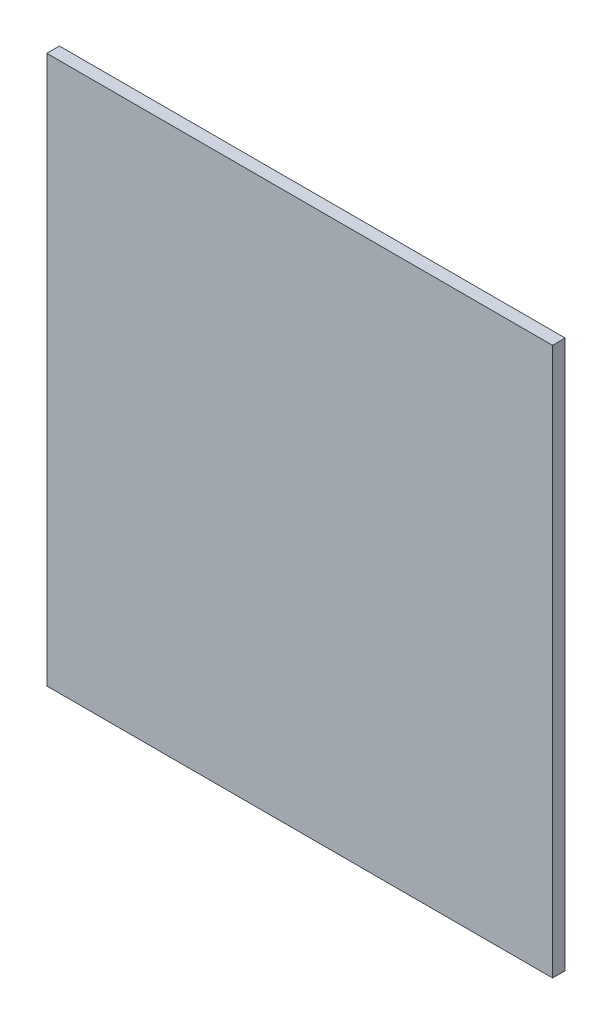
from build123d import *

# Parameters (mm, degrees)
SKETCH_1_W      = 120
SKETCH_1_H      = 130
EXTRUDE_1_DEPTH = 3


with BuildPart() as part:
    # 草图1 → 凸台-拉伸1 (new body)
    with BuildSketch(Plane.XY):
        Rectangle(SKETCH_1_W, SKETCH_1_H)
    extrude(amount=EXTRUDE_1_DEPTH)


solid = part.part
